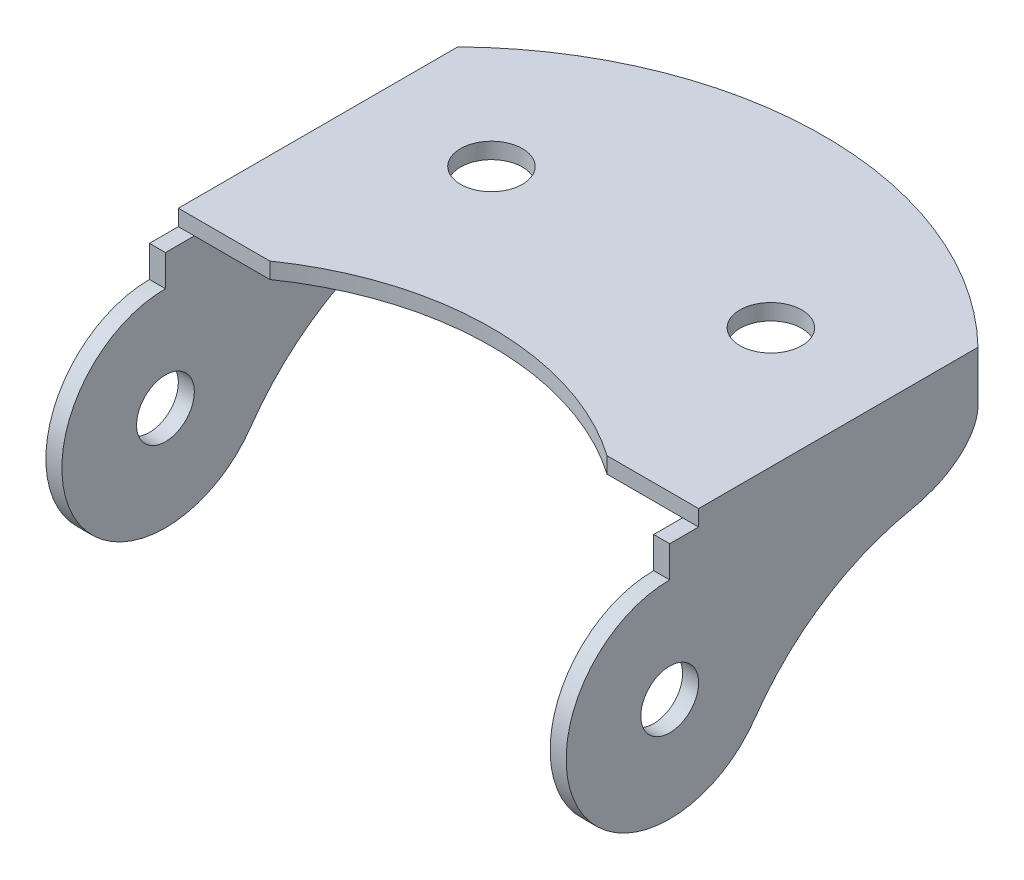
from build123d import *

# Parameters (mm, degrees)
SKETCH1_R             = 1.60655
BOSS_EXTRUDE1_DEPTH   = 0.83
BOSS_EXTRUDE4_START   = 13.5
SKETCH3_R             = 1.5
BOSS_EXTRUDE4_DEPTH   = 0.83
BOSS_EXTRUDE5_START   = -12.67
SKETCH3_5_R           = 1.5
BOSS_EXTRUDE5_DEPTH   = 0.83
BODY_MOVE_COPY1_ANGLE = 180


with BuildPart() as part:
    # Sketch1 → Boss-Extrude1 (new body)
    with BuildSketch(Plane(origin=(0, 0, 0), x_dir=(1, 0, 0), z_dir=(0, 1, 0))):
        with BuildLine():
            Line((13.5, -4.5), (13.5, 10))
            Line((13.5, 10), (8.75, 10))
            ThreePointArc((8.75, 10), (0, 7.25), (-8.75, 10))
            Line((-8.75, 10), (-13.5, 10))
            Line((-13.5, 10), (-13.5, -4.5))
            ThreePointArc((-13.5, -4.5), (-7.288689869, -8.572238768), (0, -10))
            ThreePointArc((0, -10), (7.288689869, -8.572238768), (13.5, -4.5))
        make_face()
        with Locations(Location((-7.25, 0, 0), (0, 0, 90))):
            Circle(SKETCH1_R, mode=Mode.SUBTRACT)
        with Locations(Location((7.25, 0, 0), (0, 0, 90))):
            Circle(SKETCH1_R, mode=Mode.SUBTRACT)
    extrude(amount=BOSS_EXTRUDE1_DEPTH)

    # Sketch3 → Boss-Extrude4 (add)
    with BuildSketch(Plane(origin=(0, 0, 0), x_dir=(0, 0, -1), z_dir=(1, 0, 0)).offset(BOSS_EXTRUDE4_START)):
        with BuildLine():
            Line((-4.5, 0.83), (10, 0.83))
            Line((10, 0.83), (11.5, 0.83))
            Line((11.5, 0.83), (11.5, 2.455))
            ThreePointArc((11.5, 2.455), (16.261860542, 10.323052182), (7.082672814, 10.892326816))
            ThreePointArc((7.082672814, 10.892326816), (2.026582548, 6.580128686), (-4.5, 5.33))
            Line((-4.5, 5.33), (-4.5, 0.83))
        make_face()
        with Locations((11.5, 7.83)):
            Circle(SKETCH3_R, mode=Mode.SUBTRACT)
    extrude(amount=-BOSS_EXTRUDE4_DEPTH)

    # Sketch3<5> → Boss-Extrude5 (add)
    with BuildSketch(Plane(origin=(0, 0, 0), x_dir=(0, 0, -1), z_dir=(1, 0, 0)).offset(BOSS_EXTRUDE5_START)):
        with BuildLine():
            Line((-4.5, 0.83), (10, 0.83))
            Line((10, 0.83), (11.5, 0.83))
            Line((11.5, 0.83), (11.5, 2.455))
            ThreePointArc((11.5, 2.455), (16.261860542, 10.323052182), (7.082672814, 10.892326816))
            ThreePointArc((7.082672814, 10.892326816), (2.026582548, 6.580128686), (-4.5, 5.33))
            Line((-4.5, 5.33), (-4.5, 0.83))
        make_face()
        with Locations((11.5, 7.83)):
            Circle(SKETCH3_5_R, mode=Mode.SUBTRACT)
    extrude(amount=-BOSS_EXTRUDE5_DEPTH)

    # Fillet4
    # an asymmetric fillet: 4, 3 mm, written as the material it takes off along each edge
    with BuildSketch(Plane(origin=(-4.106690229, 5.33, 4.5), x_dir=(0, -1, 0), z_dir=(-1, 0, 0))) as fillet4_piece_1:
        with BuildLine():
            Bezier((2.727713921, 0), (0.459985745, 0), (-0.21539832, -3.418544638), weights=[1, 0.772599008, 1])
            ThreePointArc((-0.21539832, -3.418544638), (0.005386199, -1.716397689), (0, 0))
            Line((0, 0), (2.727713921, 0))
        make_face()
    extrude(amount=17.956619542, mode=Mode.SUBTRACT)

    # Fillet5
    # an asymmetric fillet: 4, 3 mm, written as the material it takes off along each edge
    with BuildSketch(Plane(origin=(22.063309771, 5.33, 4.5), x_dir=(0, -1, 0), z_dir=(-1, 0, 0))) as fillet5_piece_1:
        with BuildLine():
            Bezier((2.727713921, 0), (0.459985745, 0), (-0.21539832, -3.418544638), weights=[1, 0.772599008, 1])
            ThreePointArc((-0.21539832, -3.418544638), (0.005386199, -1.716397689), (0, 0))
            Line((0, 0), (2.727713921, 0))
        make_face()
    extrude(amount=17.956619542, mode=Mode.SUBTRACT)


with BuildPart() as part_1:
    # Body-Move/Copy1: moved
    add(part.part.moved(Location((0, 0, 0))).rotate(Axis((0, 6.6025, -3.4375), (1, 0, 0)), BODY_MOVE_COPY1_ANGLE))


solid = part_1.part
